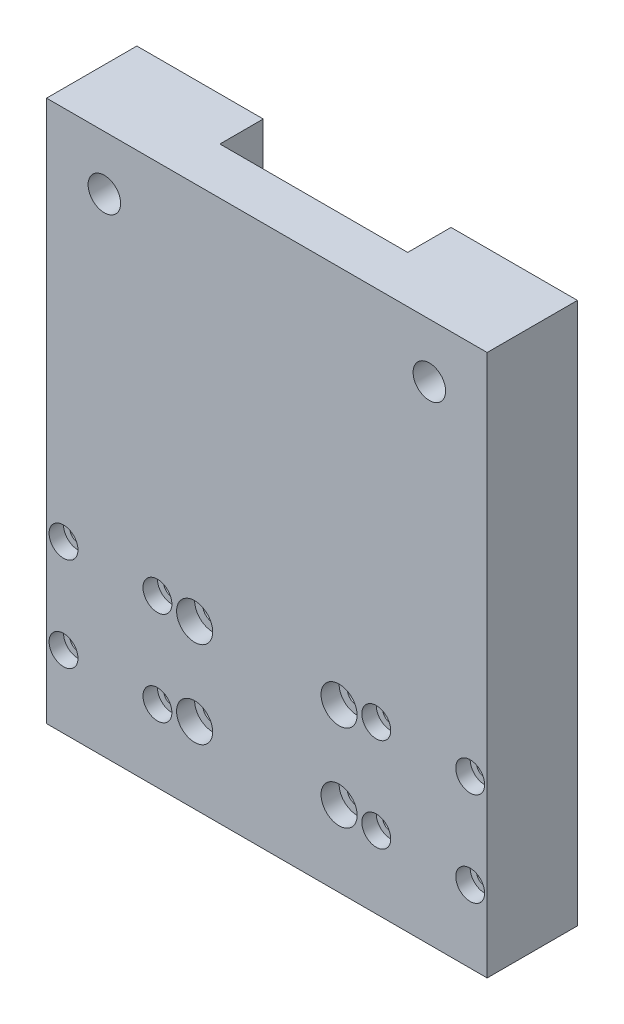
from build123d import *

# Parameters (mm, degrees)
SKETCH1_W                      = 122
SKETCH1_H                      = 150
BOSS_EXTRUDE1_DEPTH            = 25
CBORE_FOR_M4_SHCS1_D           = 4.5
CBORE_FOR_M4_SHCS1_CBORE_D     = 8
CBORE_FOR_M4_SHCS1_CBORE_DEPTH = 4
SKETCH4_W                      = 52
SKETCH4_H                      = 12
CUT_EXTRUDE1_DEPTH             = 195.958970042
CBORE_FOR_M5_SHCS1_D           = 5.5
CBORE_FOR_M5_SHCS1_CBORE_D     = 10
CBORE_FOR_M5_SHCS1_CBORE_DEPTH = 5
CBORE_FOR_M8_SHCS1_D           = 9
CBORE_FOR_M8_SHCS1_CBORE_D     = 15
CBORE_FOR_M8_SHCS1_CBORE_DEPTH = 8


with BuildPart() as part:
    # Sketch1 → Boss-Extrude1 (new body)
    with BuildSketch(Plane.XY):
        with Locations((61, 75)):
            Rectangle(SKETCH1_W, SKETCH1_H)
    extrude(amount=BOSS_EXTRUDE1_DEPTH)

    # CBORE for M4 SHCS1 (through all)
    with Locations(Plane(origin=(4.7, 46, 25), x_dir=(1, 0, 0), z_dir=(0, 0, 1))):
        with Locations((0, 0), (26, 0), (0, -26), (26, -26), (86.6, 0), (112.6, 0), (112.6, -26), (86.6, -26)):
            CounterBoreHole(CBORE_FOR_M4_SHCS1_D / 2, CBORE_FOR_M4_SHCS1_CBORE_D / 2, CBORE_FOR_M4_SHCS1_CBORE_DEPTH)

    # Sketch4 → Cut-Extrude1 (cut, through all)
    with BuildSketch(Plane(origin=(0, 0, 0), x_dir=(1, 0, 0), z_dir=(0, 1, 0))):
        with Locations((61, -6)):
            Rectangle(SKETCH4_W, SKETCH4_H)
    extrude(amount=CUT_EXTRUDE1_DEPTH, mode=Mode.SUBTRACT)

    # CBORE for M5 SHCS1 (through all)
    with Locations(Plane(origin=(41, 45, 25), x_dir=(1, 0, 0), z_dir=(0, 0, 1))):
        with Locations((0, 0), (40, 0), (40, -24), (0, -24)):
            CounterBoreHole(CBORE_FOR_M5_SHCS1_D / 2, CBORE_FOR_M5_SHCS1_CBORE_D / 2, CBORE_FOR_M5_SHCS1_CBORE_DEPTH)

    # CBORE for M8 SHCS1 (through all)
    with Locations(Plane(origin=(106, 135, 0), x_dir=(-1, 0, 0), z_dir=(0, 0, -1))):
        with Locations((0, 0), (90, 0)):
            CounterBoreHole(CBORE_FOR_M8_SHCS1_D / 2, CBORE_FOR_M8_SHCS1_CBORE_D / 2, CBORE_FOR_M8_SHCS1_CBORE_DEPTH)


solid = part.part
